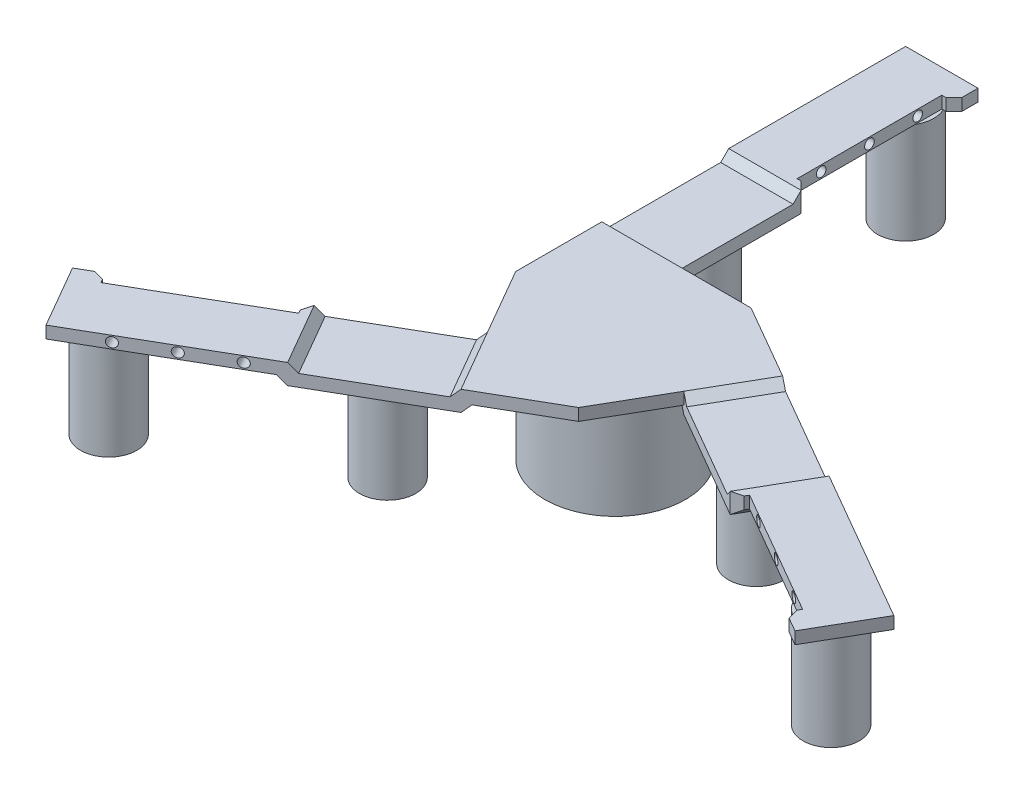
from build123d import *

# Parameters (mm, degrees)
SALIENTE_EXTRUIR2_DEPTH = 1
CROQUIS2_R              = 17.500000000000004
CROQUIS2_R_2            = 15.500000000000004
CROQUIS2_R_3            = 7.000000000000005
CROQUIS2_R_4            = 5.000000000000002
CROQUIS2_R_5            = 7.000000000010954
CROQUIS2_R_6            = 5.0000000000000036
CROQUIS2_R_7            = 7.000000000013004
CROQUIS2_R_8            = 5.000000000000005
CROQUIS2_R_9            = 6.999999999999999
CROQUIS2_R_10           = 4.999999999999999
CROQUIS2_R_11           = 7
CROQUIS2_R_12           = 4.999999999999997
CROQUIS2_R_13           = 6.999999999999995
CROQUIS2_R_14           = 5.000000000000001
SALIENTE_EXTRUIR3_DEPTH = 25
SALIENTE_EXTRUIR4_START = 1
SALIENTE_EXTRUIR4_DEPTH = 2
CROQUIS4_W              = 17.999999999999996
CROQUIS4_H              = 31.565871256335136
SALIENTE_EXTRUIR5_DEPTH = 2
CHAFL_N1_SIZE           = 2
CORTAR_EXTRUIR3_REACH   = 141.007
CROQUIS11_R             = 1.2000000000000004
CROQUIS11_R_2           = 1.200000000000001
CROQUIS11_5_R           = 1.2000000000000004
CROQUIS11_5_R_2         = 1.200000000000001
CORTAR_EXTRUIR6_DEPTH   = 9.75
MATRIZC5_COUNT          = 3
CHAFL_N4_SIZE           = 2


with BuildPart() as part:
    # Croquis1 → Saliente-Extruir2 (new body)
    with BuildSketch(Plane(origin=(0, 0, 0), x_dir=(1, 0, 0), z_dir=(0, 1, 0))):
        Polygon((-24.75, 0), (-24.75, 97), (-6.750000000000003, 97), (-6.750000000000004, 21.434128743664857), (12.375000000000004, 21.43412874366486), (96.3794641670906, -27.065871256335015), (87.3794641670906, -42.65432852445492), (21.937499999999993, -4.871392896287427), (12.375000000000004, -21.43412874366486), (-71.62946416709052, -69.93412874366491), (-80.62946416709053, -54.345671475545046), (-15.187499999999979, -16.562735847377407), align=None)
    extrude(amount=SALIENTE_EXTRUIR2_DEPTH)

    # Croquis2 → Saliente-Extruir3 (add)
    # profile 1 of 7: a face of its own
    with BuildSketch(Plane(origin=(0, 0, 0), x_dir=(1, 0, 0), z_dir=(0, 1, 0))):
        with Locations(Location((0, 0, 0), (0, 0, 270))):
            Circle(CROQUIS2_R)
        with Locations(Location((0, 0, 0), (0, 0, 270))):
            Circle(CROQUIS2_R_2, mode=Mode.SUBTRACT)
    # profile 2 of 7: a face of its own
    with BuildSketch(Plane(origin=(0, 0, 0), x_dir=(1, 0, 0), z_dir=(0, 1, 0))):
        with Locations(Location((-15.75, 88.00000000000001, 0), (0, 0, 270))):
            Circle(CROQUIS2_R_3)
        with Locations(Location((-15.75, 88.00000000000001, 0), (0, 0, 270))):
            Circle(CROQUIS2_R_4, mode=Mode.SUBTRACT)
    # profile 3 of 7: a face of its own
    with BuildSketch(Plane(origin=(0, 0, 0), x_dir=(1, 0, 0), z_dir=(0, 1, 0))):
        with Locations(Location((84.08523553304072, -30.36009989038661, 0), (0, 0, 270))):
            Circle(CROQUIS2_R_5)
        with Locations(Location((84.08523553304073, -30.360099890386614, 0), (0, 0, 270))):
            Circle(CROQUIS2_R_6, mode=Mode.SUBTRACT)
    # profile 4 of 7: a face of its own
    with BuildSketch(Plane(origin=(0, 0, 0), x_dir=(1, 0, 0), z_dir=(0, 1, 0))):
        with Locations(Location((-68.3352355330182, -57.639900109609464, 0), (0, 0, 270))):
            Circle(CROQUIS2_R_7)
        with Locations(Location((-68.3352355330182, -57.639900109609464, 0), (0, 0, 270))):
            Circle(CROQUIS2_R_8, mode=Mode.SUBTRACT)
    # profile 5 of 7: a face of its own
    with BuildSketch(Plane(origin=(0, 0, 0), x_dir=(1, 0, 0), z_dir=(0, 1, 0))):
        with Locations(Location((-15.749999999999986, 37.217064371832436, 0), (0, 0, 270))):
            Circle(CROQUIS2_R_9)
        with Locations(Location((-15.749999999999986, 37.217064371832436, 0), (0, 0, 270))):
            Circle(CROQUIS2_R_10, mode=Mode.SUBTRACT)
    # profile 6 of 7: a face of its own
    with BuildSketch(Plane(origin=(0, 0, 0), x_dir=(1, 0, 0), z_dir=(0, 1, 0))):
        with Locations(Location((40.105923200287606, -4.968632076311503, 0), (0, 0, 270))):
            Circle(CROQUIS2_R_11)
        with Locations(Location((40.105923200287606, -4.968632076311503, 0), (0, 0, 270))):
            Circle(CROQUIS2_R_12, mode=Mode.SUBTRACT)
    # profile 7 of 7: a face of its own
    with BuildSketch(Plane(origin=(0, 0, 0), x_dir=(1, 0, 0), z_dir=(0, 1, 0))):
        with Locations(Location((-24.35592320028792, -32.24843229552088, 0), (0, 0, 270))):
            Circle(CROQUIS2_R_13)
        with Locations(Location((-24.35592320028792, -32.24843229552088, 0), (0, 0, 270))):
            Circle(CROQUIS2_R_14, mode=Mode.SUBTRACT)
    extrude(amount=-SALIENTE_EXTRUIR3_DEPTH)

    # Croquis3 → Saliente-Extruir4 (add)
    with BuildSketch(Plane(origin=(0, 0, 0), x_dir=(1, 0, 0), z_dir=(0, 1, 0)).offset(SALIENTE_EXTRUIR4_START)):
        Polygon((-24.75, 97), (-6.7500000000000036, 97), (-6.7500000000000036, 53.00000000000001), (-24.749999999999993, 53.00000000000001), align=None)
        Polygon((96.37946416709256, -27.065871256333594), (58.27434640057726, -5.06587125633361), (49.27434640057727, -20.654328524453497), (87.37946416709256, -42.65432852445349), align=None)
        Polygon((-71.62946416708819, -69.93412874366587), (-33.5243464005729, -47.934128743665845), (-42.52434640057291, -32.34567147554596), (-80.6294641670882, -54.34567147554598), align=None)
        Polygon((-6.750000000000004, 21.434128743664857), (-24.75, 21.434128743664868), (-24.75, 0), (-15.187499999999979, -16.562735847377407), (-6.187499999999971, -32.151193115497286), (12.375000000000004, -21.43412874366486), (21.937499999999993, -4.871392896287427), (30.937500000000007, 10.717064371832583), (12.375000000000004, 21.43412874366486), align=None)
    extrude(amount=SALIENTE_EXTRUIR4_DEPTH)

    # Croquis4 → Saliente-Extruir5 (add)
    with BuildSketch(Plane(origin=(0, 0, 0), x_dir=(1, 0, 0), z_dir=(0, 1, 0))):
        Polygon((58.27434640057523, -5.065871256335415), (30.937500000000057, 10.717064371832285), (21.937499999999986, -4.87139289628757), (49.27434640057516, -20.654328524455266), align=None)
        with Locations((-15.750000000000002, 37.21706437183242)):
            Rectangle(CROQUIS4_W, CROQUIS4_H)
        Polygon((-33.52434640057567, -47.93412874366454), (-6.187500000000291, -32.15119311549722), (-15.187500000000146, -16.562735847377255), (-42.52434640057553, -32.34567147554457), align=None)
    extrude(amount=-SALIENTE_EXTRUIR5_DEPTH)

    # Chaflán1
    chafl_n1_edges = [part.edges().sort_by_distance(p)[0] for p in [
        (-38.02434640057291, 1, 40.139900109605904),
        (53.774346400577265, 1, 12.860099890393553),
        (-15.749999999999998, 1, -53.00000000000001),
        (-10.687499999999973, 1, 24.35696448143735),
        (26.4375, 1, -2.92283573777258),
        (-15.75, 1, -21.434128743664868),
        (-15.750000000000004, 0, -21.434128743664857),
        (-15.750000000000002, 0, -52.99999999999999),
        (26.43750000000002, 0, -2.922835737772358),
        (53.7743464005752, 0, 12.86009989039534),
        (-10.687500000000218, 0, 24.356964481437238),
        (-38.0243464005756, 0, 40.139900109604554),
    ]]
    chamfer(chafl_n1_edges, length=CHAFL_N1_SIZE - 0.0001)  # a hair under: the kernel refuses the full size

    # Croquis11 → Cortar-Extruir3 (cut, up to next)
    with BuildSketch(Plane(origin=(0, 0, 0), x_dir=(0, 0, -1), z_dir=(1, 0, 0)), mode=Mode.PRIVATE) as cortar_extruir3_sk1:
        with Locations((61.000000000000014, 1.4999999999999953)):
            Circle(CROQUIS11_R)
    cortar_extruir3_tool1 = extrude(cortar_extruir3_sk1.sketch, amount=-CORTAR_EXTRUIR3_REACH, mode=Mode.PRIVATE) & part.part
    # Croquis11 → Cortar-Extruir3 (cut, up to next)
    with BuildSketch(Plane(origin=(0, 0, 0), x_dir=(0, 0, -1), z_dir=(1, 0, 0)), mode=Mode.PRIVATE) as cortar_extruir3_sk2:
        with Locations((73.00000000000001, 1.4999999999999967)):
            Circle(CROQUIS11_R_2)
    cortar_extruir3_tool2 = extrude(cortar_extruir3_sk2.sketch, amount=-CORTAR_EXTRUIR3_REACH, mode=Mode.PRIVATE) & part.part
    # Croquis11 → Cortar-Extruir3 (cut, up to next)
    with BuildSketch(Plane(origin=(0, 0, 0), x_dir=(0, 0, -1), z_dir=(1, 0, 0)), mode=Mode.PRIVATE) as cortar_extruir3_sk3:
        with Locations((85, 1.4999999999999982)):
            Circle(CROQUIS11_R_2)
    cortar_extruir3_tool3 = extrude(cortar_extruir3_sk3.sketch, amount=-CORTAR_EXTRUIR3_REACH, mode=Mode.PRIVATE) & part.part
    cortar_extruir3_1 = cortar_extruir3_tool1.solids().sort_by_distance((0, 1.5, -61))[0]
    add(cortar_extruir3_1, mode=Mode.SUBTRACT)
    cortar_extruir3_2 = cortar_extruir3_tool2.solids().sort_by_distance((0, 1.5, -73))[0]
    add(cortar_extruir3_2, mode=Mode.SUBTRACT)
    cortar_extruir3_3 = cortar_extruir3_tool3.solids().sort_by_distance((0, 1.5, -85))[0]
    add(cortar_extruir3_3, mode=Mode.SUBTRACT)
    cortar_extruir3 = cortar_extruir3_1 + cortar_extruir3_2 + cortar_extruir3_3  # Cortar-Extruir3 as one shape, for the pattern or mirror that repeats it

    # Croquis11<5> → Cortar-Extruir6 (cut)
    with BuildSketch(Plane(origin=(0, 0, 0), x_dir=(0, 0, -1), z_dir=(1, 0, 0))):
        Polygon((54.99999999999999, -3.8e-16), (91.00000000000003, -3.8e-16), (91.00000000000009, 3), (55.00000000000002, 2.9999999999999893), align=None)
        with Locations((61.000000000000014, 1.4999999999999953)):
            Circle(CROQUIS11_5_R, mode=Mode.SUBTRACT)
        with Locations((73.00000000000001, 1.4999999999999967)):
            Circle(CROQUIS11_5_R_2, mode=Mode.SUBTRACT)
        with Locations((85, 1.4999999999999982)):
            Circle(CROQUIS11_5_R_2, mode=Mode.SUBTRACT)
    cortar_extruir6 = extrude(amount=-CORTAR_EXTRUIR6_DEPTH, mode=Mode.SUBTRACT)

    # MatrizC5: Cortar-Extruir3, Cortar-Extruir6 ×3 about axis
    matrizc5_axis = Axis((-4.81e-15, 0, 2.27e-15), (0, 1, 0))
    add([cortar_extruir3.rotate(matrizc5_axis, i * 360 / MATRIZC5_COUNT) for i in range(1, MATRIZC5_COUNT)], mode=Mode.SUBTRACT)
    add([cortar_extruir6.rotate(matrizc5_axis, i * 360 / MATRIZC5_COUNT) for i in range(1, MATRIZC5_COUNT)], mode=Mode.SUBTRACT)

    # Chaflán4
    chafl_n4_edges = [part.edges().sort_by_distance(p)[0] for p in [
        (-6.7500000000000036, 1.4999999999999996, -91.00000000000006),
        (-6.7500000000000036, 1.4999999999999944, -55.00000000000001),
        (-75.43331174438393, 1.4999999999999996, 51.34567147554506),
        (-44.25639720814411, 1.4999999999999944, 33.34567147554502),
        (82.18331174438404, 1.4999999999999996, 39.65432852445497),
        (51.00639720814418, 1.4999999999999944, 21.654328524454982),
    ]]
    chamfer(chafl_n4_edges, length=CHAFL_N4_SIZE)


solid = part.part
